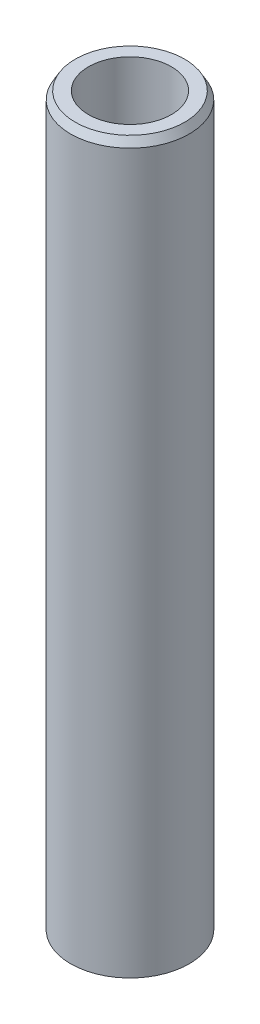
from build123d import *
from OCP.BRepFilletAPI import BRepFilletAPI_MakeChamfer

# Parameters (mm, degrees)
SKETCH1_R           = 37.5
BOSS_EXTRUDE1_DEPTH = 462.536337046
SKETCH2_R           = 26.243504614
CUT_EXTRUDE1_DEPTH  = 466.566711748
CHAMFER1_SIZE       = 5.020019329
CHAMFER1_SIZE2      = 2.898309511


with BuildPart() as part:
    # Sketch1 → Boss-Extrude1 (new body)
    with BuildSketch(Plane(origin=(0, 0, 0), x_dir=(1, 0, 0), z_dir=(0, 1, 0))):
        Circle(SKETCH1_R)
    extrude(amount=BOSS_EXTRUDE1_DEPTH)

    # Sketch2 → Cut-Extrude1 (cut, through all)
    with BuildSketch(Plane(origin=(0, 0, 0), x_dir=(1, 0, 0), z_dir=(0, 1, 0))):
        Circle(SKETCH2_R)
    extrude(amount=CUT_EXTRUDE1_DEPTH, mode=Mode.SUBTRACT)

    # Chamfer1: one chamfer whose edges measure the first distance from different faces: ONE call of the kernel's chamfer builder (chamfer() names one face for all edges)
    chamfer1_edges_1 = [part.edges().sort_by_distance(p)[0] for p in [
        (-37.5, 462.536337046, 0),
    ]]
    chamfer1_side_1 = [part.faces().sort_by_distance(p)[0] for p in [
        (-37.5, 231.268168523, 0),
    ]]
    chamfer1_edges_2 = [part.edges().sort_by_distance(p)[0] for p in [
        (-37.5, 0, 0),
    ]]
    chamfer1_side_2 = [part.faces().sort_by_distance(p)[0] for p in [
        (-36.439339828, 0, 0),
    ]]
    chamfer1 = BRepFilletAPI_MakeChamfer(part.part.solid().wrapped)
    for e in chamfer1_edges_1:
        chamfer1.Add(CHAMFER1_SIZE, CHAMFER1_SIZE2, e.wrapped, chamfer1_side_1[0].wrapped)  # the first distance lies on this face
    for e in chamfer1_edges_2:
        chamfer1.Add(CHAMFER1_SIZE, CHAMFER1_SIZE2, e.wrapped, chamfer1_side_2[0].wrapped)  # the first distance lies on this face
    add(Compound.cast(chamfer1.Shape()), mode=Mode.REPLACE)


solid = part.part
